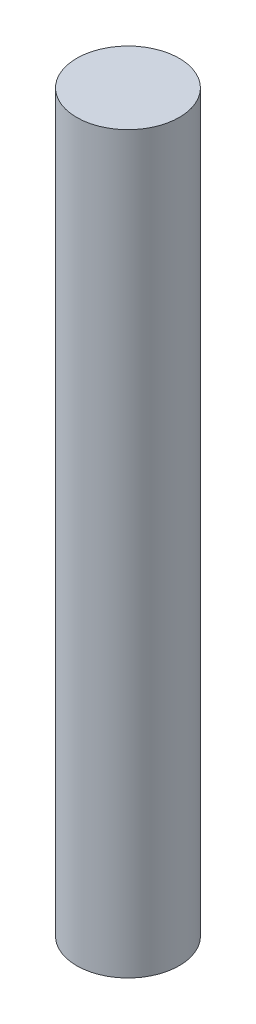
from build123d import *

# Parameters (mm, degrees)
SKETCH_1_R      = 1.5
EXTRUDE_1_DEPTH = 21.5


with BuildPart() as part:
    # 草图1 → 凸台-拉伸1 (new body)
    with BuildSketch(Plane(origin=(0, 0, 0), x_dir=(1, 0, 0), z_dir=(0, 1, 0))):
        Circle(SKETCH_1_R)
    extrude(amount=EXTRUDE_1_DEPTH)


solid = part.part
